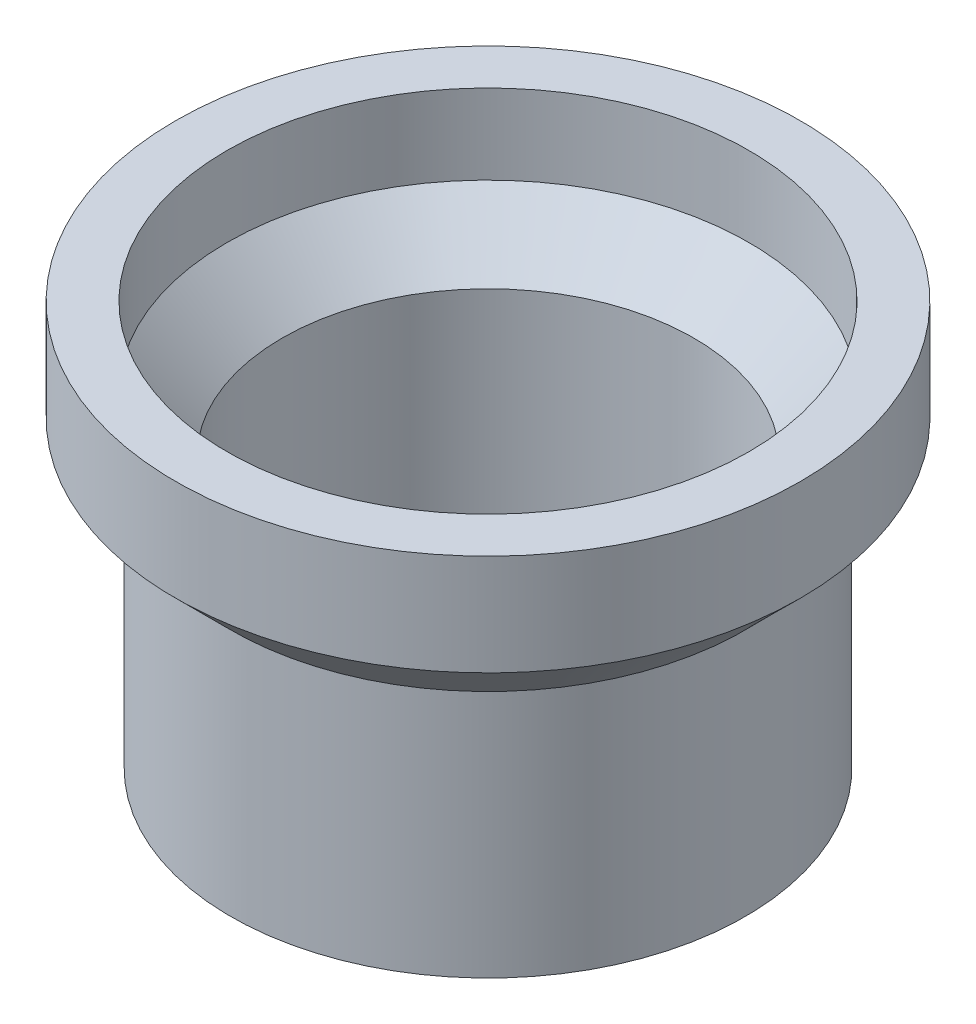
from build123d import *

# Parameters (mm, degrees)
CHAMFER1_SIZE = 2


with BuildPart() as part:
    # Sketch1 → Revolve1 (revolve)
    with BuildSketch(Plane.XY):
        Polygon((17, 0), (17, -5.5), (14, -8.5), (14, -22), (11.2, -22), (11.2, -7.340202025), (14.2, -4.340202025), (14.2, 0), align=None)
    revolve(axis=Axis((0, 16.279491968, 0), (0, -1, 0)))

    # Chamfer1
    chamfer1_edges = [part.edges().sort_by_distance(p)[0] for p in [
        (-11.2, -22, 0),
    ]]
    chamfer(chamfer1_edges, length=CHAMFER1_SIZE)


solid = part.part
